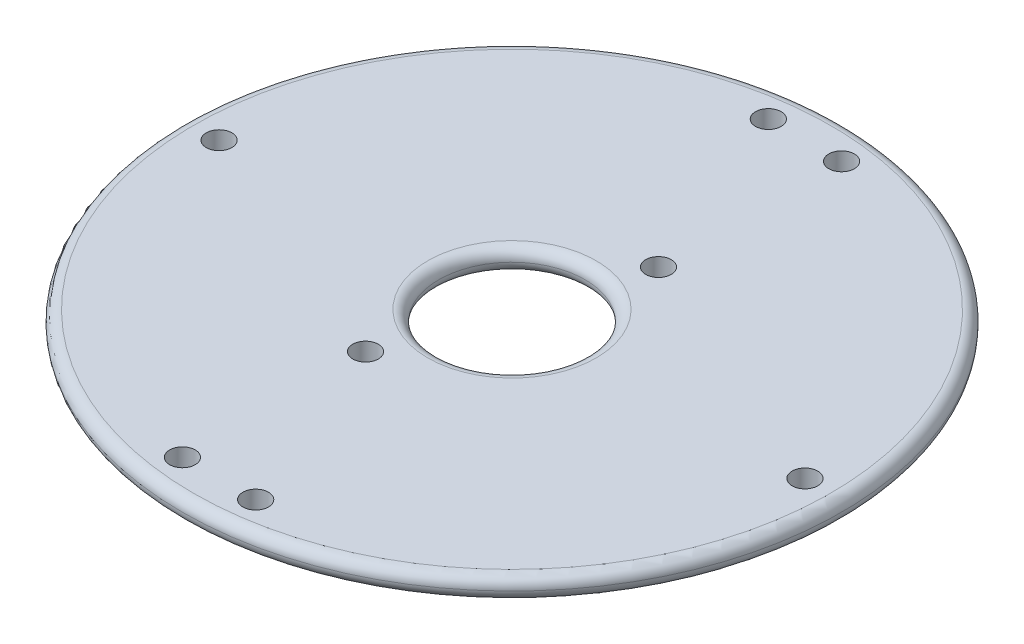
from build123d import *

# Parameters (mm, degrees)
SKETCH1_R           = 45
BOSS_EXTRUDE1_DEPTH = 3
SKETCH2_R           = 1.75
CUT_EXTRUDE1_DEPTH  = 10
SKETCH3_R           = 10
CUT_EXTRUDE2_DEPTH  = 5
FILLET1_R           = 1.5
FILLET2_R           = 1.5


with BuildPart() as part:
    # Sketch1 → Boss-Extrude1 (new body)
    with BuildSketch(Plane(origin=(0, 0, 0), x_dir=(1, 0, 0), z_dir=(0, 1, 0))):
        with Locations(Location((0, 0, 0), (0, 0, 270))):
            Circle(SKETCH1_R)
    extrude(amount=BOSS_EXTRUDE1_DEPTH)

    # Sketch2 → Cut-Extrude1 (cut)
    with BuildSketch(Plane(origin=(0, 3, 0), x_dir=(1, 0, 0), z_dir=(0, 1, 0))):
        with Locations(Location((-5, -40, 0), (0, 0, 270))):
            Circle(SKETCH2_R)
        with Locations(Location((5, -40, 0), (0, 0, 270))):
            Circle(SKETCH2_R)
        with Locations(Location((-5, 40, 0), (0, 0, 270))):
            Circle(SKETCH2_R)
        with Locations(Location((5, 40, 0), (0, 0, 270))):
            Circle(SKETCH2_R)
        with Locations(Location((-40, 0, 0), (0, 0, 270))):
            Circle(SKETCH2_R)
        with Locations(Location((40, 0, 0), (0, 0, 270))):
            Circle(SKETCH2_R)
        with Locations(Location((-5, -15, 0), (0, 0, 270))):
            Circle(SKETCH2_R)
        with Locations(Location((5, 15, 0), (0, 0, 270))):
            Circle(SKETCH2_R)
    extrude(amount=-CUT_EXTRUDE1_DEPTH, mode=Mode.SUBTRACT)

    # Sketch3 → Cut-Extrude2 (cut)
    with BuildSketch(Plane(origin=(0, 3, 0), x_dir=(1, 0, 0), z_dir=(0, 1, 0))):
        with Locations(Location((0, 0, 0), (0, 0, 270))):
            Circle(SKETCH3_R)
    extrude(amount=-CUT_EXTRUDE2_DEPTH, mode=Mode.SUBTRACT)

    # Fillet1
    fillet1_edges = [part.edges().sort_by_distance(p)[0] for p in [
        (0, 0, -45),
        (0, 3, -45),
    ]]
    fillet(fillet1_edges, radius=FILLET1_R - 0.0001)  # a hair under: the kernel refuses the full size

    # Fillet2
    fillet2_edges = [part.edges().sort_by_distance(p)[0] for p in [
        (0, 0, -10),
        (0, 3, -10),
    ]]
    fillet(fillet2_edges, radius=FILLET2_R - 0.0001)  # a hair under: the kernel refuses the full size


solid = part.part
